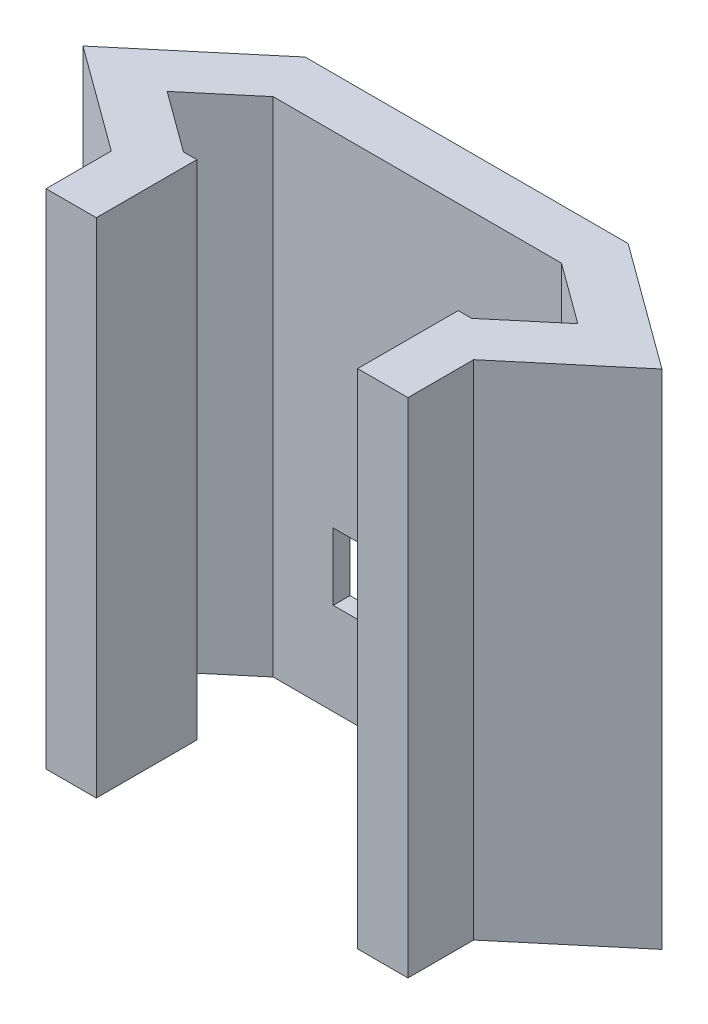
from build123d import *

# Parameters (mm, degrees)
BOSS_EXTRUDE2_DEPTH = 30
SKETCH21_W          = 20
SKETCH21_H          = 23
CUT_EXTRUDE18_DEPTH = 2
SKETCH22_W          = 10
SKETCH22_H          = 4
CUT_EXTRUDE19_DEPTH = 39.083187574


with BuildPart() as part:
    # Sketch1 → Boss-Extrude2 (new body)
    with BuildSketch(Plane(origin=(0, 0, 0), x_dir=(1, 0, 0), z_dir=(0, 1, 0))):
        Polygon((-9.289540275, -0.938702324), (-5.852697561, 1.95337278), (11.354665719, 1.95337278), (14.971998662, -0.690062833), (11.535155949, -3.582137937), (10.725726632, -3.582137937), (10.725726632, -6.582137937), (10.725726632, -9.582137937), (13.725726632, -9.582137937), (13.725726632, -5.65962935), (19.829022843, -0.523755383), (12.334005358, 4.95337278), (-6.946990728, 4.95337278), (-14.146564456, -1.105009774), (-7.874273368, -5.688607108), (-7.874273368, -9.582137937), (-4.874273368, -9.582137937), (-4.874273368, -6.582137937), (-4.874273368, -3.582137937), (-5.672207332, -3.582137937), align=None)
    extrude(amount=BOSS_EXTRUDE2_DEPTH)

    # Sketch21 → Cut-Extrude18 (cut)
    with BuildSketch(Plane(origin=(0, 0, -4.95337278), x_dir=(-1, 0, 0), z_dir=(0, 0, -1))):
        with Locations((-2.731825158, 15)):
            Rectangle(SKETCH21_W, SKETCH21_H)
    extrude(amount=-CUT_EXTRUDE18_DEPTH, mode=Mode.SUBTRACT)

    # Sketch22 → Cut-Extrude19 (cut, through all)
    with BuildSketch(Plane(origin=(0, 0, -2.95337278), x_dir=(-1, 0, 0), z_dir=(0, 0, -1))):
        with Locations((-2.731825158, 7.5)):
            Rectangle(SKETCH22_W, SKETCH22_H)
    extrude(amount=-CUT_EXTRUDE19_DEPTH, mode=Mode.SUBTRACT)


solid = part.part
